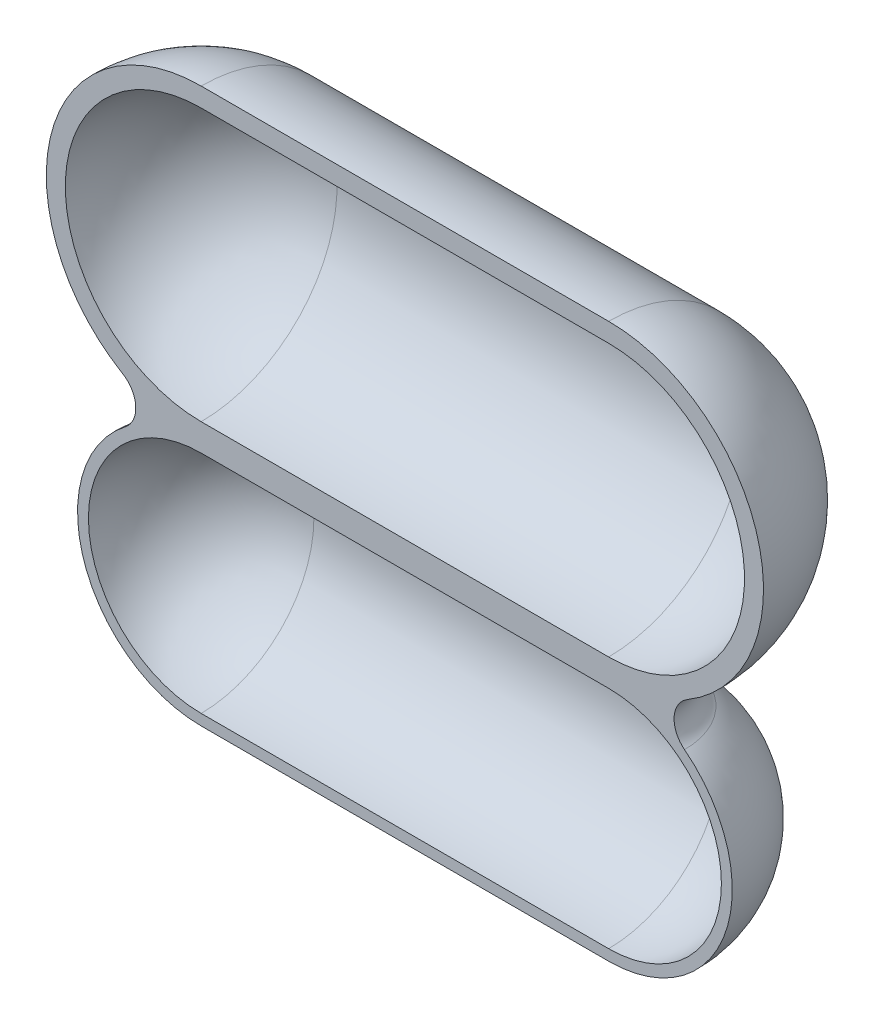
from build123d import *

# Parameters (mm, degrees)
BOSS_EXTRUDE1_DEPTH = 150
REVOLVE1_ANGLE      = 90
MIRROR1_ANGLE       = 90


# Read off the part's stored shape, not the designer's step: Mirror1
with BuildPart() as part:
    # Sketch2 → Boss-Extrude1 (new body)
    with BuildSketch(Plane(origin=(0, 0, 0), x_dir=(0, 0, -1), z_dir=(1, 0, 0))):
        with BuildLine():
            Line((0, 5), (0, -5))
            ThreePointArc((0, -5), (41.5, -46.5), (0, -88))
            Line((0, -88), (0, -92))
            ThreePointArc((0, -92), (43.037511543, -61.265588379), (27.932931003, -10.583410997))
            ThreePointArc((27.932931003, -10.583410997), (24.092356291, -2.052490679), (28.986658103, 5.920741122))
            ThreePointArc((28.986658103, 5.920741122), (54.98416934, 70.024683756), (0, 112))
            Line((0, 112), (0, 105))
            ThreePointArc((0, 105), (50, 55), (0, 5))
        make_face()
    extrude(amount=BOSS_EXTRUDE1_DEPTH)

    # Sketch2<2> → Revolve1 (revolve)
    with BuildSketch(Plane(origin=(0, 0, 0), x_dir=(0, 0, -1), z_dir=(1, 0, 0))):
        with BuildLine():
            Line((0, 5), (0, -5))
            ThreePointArc((0, -5), (41.5, -46.5), (0, -88))
            Line((0, -88), (0, -92))
            ThreePointArc((0, -92), (43.037511543, -61.265588379), (27.932931003, -10.583410997))
            ThreePointArc((27.932931003, -10.583410997), (24.092356291, -2.052490679), (28.986658103, 5.920741122))
            ThreePointArc((28.986658103, 5.920741122), (54.98416934, 70.024683756), (0, 112))
            Line((0, 112), (0, 105))
            ThreePointArc((0, 105), (50, 55), (0, 5))
        make_face()
    revolve(axis=Axis((0, 105, 0), (0, 1, 0)), revolution_arc=REVOLVE1_ANGLE)

    # Mirror1 outline → Mirror1 (revolve)
    with BuildSketch(Plane(origin=(150, 0, 0), x_dir=(1, 0, 0), z_dir=(0, 0, 1))):
        with BuildLine():
            ThreePointArc((28.986658103, 5.920741122), (54.98416934, 70.024683756), (0, 112))
            Line((0, 112), (0, 105))
            ThreePointArc((0, 105), (50, 55), (0, 5))
            Line((0, 5), (0, -5))
            ThreePointArc((0, -5), (41.5, -46.5), (0, -88))
            Line((0, -88), (0, -92))
            ThreePointArc((0, -92), (43.037511543, -61.265588379), (27.932931003, -10.583410997))
            ThreePointArc((27.932931003, -10.583410997), (24.092356291, -2.052490679), (28.986658103, 5.920741122))
        make_face()
    revolve(axis=Axis((150, 0, 0), (0, 1, 0)), revolution_arc=MIRROR1_ANGLE)


solid = part.part
